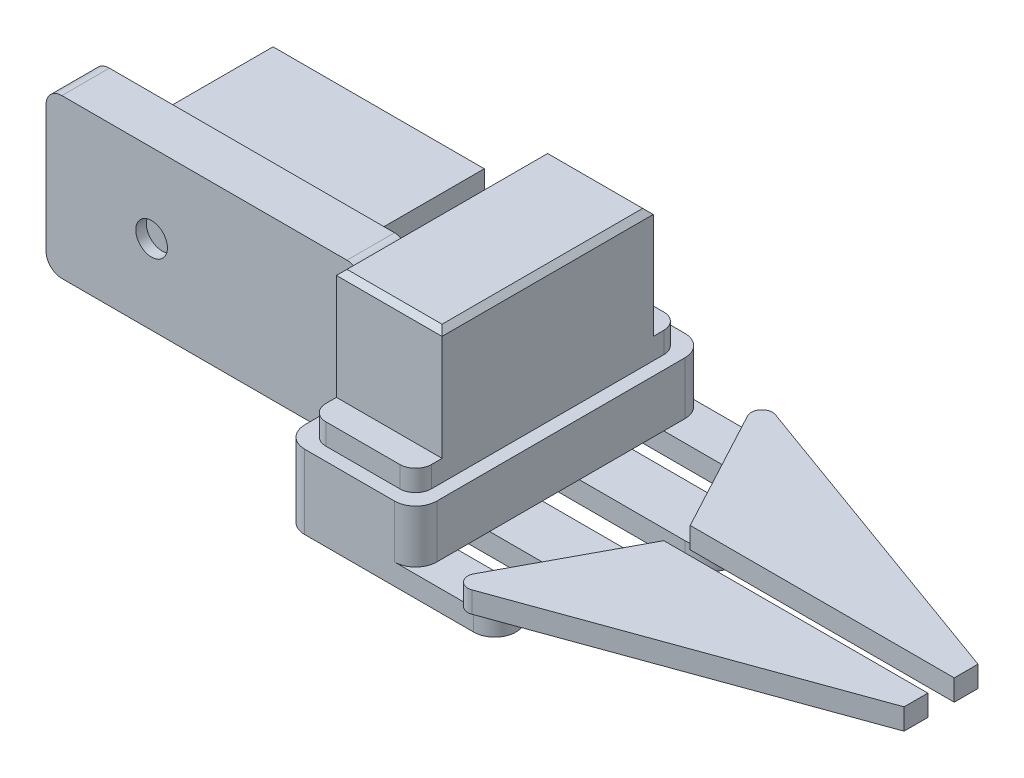
from build123d import *

# Parameters (mm, degrees)
SKETCH_1_W          = 60
SKETCH_1_H          = 30
EXTRUDE_1_DEPTH     = 9
SKETCH_2_W          = 25
SKETCH_2_H          = 55
EXTRUDE_2_DEPTH     = 10
SKETCH_3_W          = 20
SKETCH_3_H          = 40
EXTRUDE_3_DEPTH     = 25
SKETCH_4_W          = 20
SKETCH_4_H          = 5
EXTRUDE_4_DEPTH     = 4
FILLET_1_R          = 4
FILLET_2_R          = 3
FILLET_3_R          = 3
EXTRUDE_5_DEPTH     = 4
EXTRUDE_6_DEPTH     = 4
FILLET_4_R          = 2
CHAMFER_1_SIZE      = 1
SKETCH_7_W          = 40
SKETCH_7_H          = 20
EXTRUDE_7_DEPTH     = 25
SKETCH_8_W          = 5
SKETCH_8_H          = 20
EXTRUDE_8_DEPTH     = 4
CHAMFER_2_SIZE      = 1
FILLET_6_R          = 2
SKETCH_9_R          = 3
CUT_EXTRUDE_1_DEPTH = 2


with BuildPart() as part:
    # 草图1 → 凸台-拉伸1 (new body)
    with BuildSketch(Plane.XY):
        Rectangle(SKETCH_1_W, SKETCH_1_H)
    extrude(amount=EXTRUDE_1_DEPTH)

    # 草图2 → 凸台-拉伸2 (add)
    with BuildSketch(Plane.XZ.offset(15)):
        with Locations((42.5, -3.5)):
            Rectangle(SKETCH_2_W, SKETCH_2_H)
    extrude(amount=-EXTRUDE_2_DEPTH)

    # 草图3 → 凸台-拉伸3 (add)
    with BuildSketch(Plane(origin=(0, -5, 0), x_dir=(1, 0, 0), z_dir=(0, 1, 0))):
        with Locations((42.5, 3.5)):
            Rectangle(SKETCH_3_W, SKETCH_3_H)
    extrude(amount=EXTRUDE_3_DEPTH)

    # 草图4 → 凸台-拉伸4 (add)
    with BuildSketch(Plane(origin=(0, -5, 0), x_dir=(1, 0, 0), z_dir=(0, 1, 0))):
        with Locations((42.5, 26)):
            Rectangle(SKETCH_4_W, SKETCH_4_H)
        with Locations((42.5, -19)):
            Rectangle(SKETCH_4_W, SKETCH_4_H)
    extrude(amount=EXTRUDE_4_DEPTH)

    # 圆角1
    fillet_1_edges = [part.edges().sort_by_distance(p)[0] for p in [
        (30, -10, -31),
        (30, -10, 24),
        (55, -10, 24),
        (55, -10, -31),
    ]]
    fillet(fillet_1_edges, radius=FILLET_1_R)

    # 圆角2
    fillet_2_edges = [part.edges().sort_by_distance(p)[0] for p in [
        (52.5, -3, -28.5),
        (32.5, -3, -28.5),
        (52.5, -3, 21.5),
        (32.5, -3, 21.5),
    ]]
    fillet(fillet_2_edges, radius=FILLET_2_R)

    # 圆角3
    fillet_3_edges = [part.edges().sort_by_distance(p)[0] for p in [
        (-30, -15, 4.5),
        (-30, 15, 4.5),
        (30, 15, 4.5),
    ]]
    fillet(fillet_3_edges, radius=FILLET_3_R)

    # 草图5 → 凸台-拉伸5 (add)
    with BuildSketch(Plane.XZ.offset(15)):
        with BuildLine():
            Line((34, 24), (66, 24))
            ThreePointArc((66, 24), (70, 20), (66, 16))
            Line((66, 16), (34, 16))
            ThreePointArc((34, 16), (30, 20), (34, 24))
        make_face()
        with BuildLine():
            Line((35, 10), (75, 10))
            ThreePointArc((75, 10), (80, 5), (75, 0))
            Line((75, 0), (35, 0))
            ThreePointArc((35, 0), (30, 5), (35, 10))
        make_face()
    extrude_5 = extrude(amount=EXTRUDE_5_DEPTH)

    # 镜向1: 凸台-拉伸5 across plane
    add(extrude_5.mirror(Plane(origin=(0, 0, -3.5), x_dir=(1, 0, 0), z_dir=(0, 0, -1))))

    # 草图6 → 凸台-拉伸6 (add)
    with BuildSketch(Plane(origin=(0, -15, 0), x_dir=(1, 0, 0), z_dir=(0, 1, 0))):
        Polygon((62, 34), (77, 6), (127, 6), (127, 10.5), align=None)
    extrude_6 = extrude(amount=EXTRUDE_6_DEPTH)

    # 镜向2: 凸台-拉伸6 across plane
    add(extrude_6.mirror(Plane(origin=(0, 0, -3.5), x_dir=(1, 0, 0), z_dir=(0, 0, -1))))

    # 圆角4
    # the kernel refuses this fillet: 2 mm, written as the material it takes off along each edge
    with BuildSketch(Plane(origin=(62, -15, -34), x_dir=(0.47222141251542, 0, 0.8814799700287814), z_dir=(0, 1, 0))) as fillet_4_piece_1:
        with BuildLine():
            CenterArc((FILLET_4_R * 2.60886248276, FILLET_4_R), FILLET_4_R, 131.944537695, 138.055462305)
            Line((FILLET_4_R * 1.94045155385, FILLET_4_R * 1.74379219551), (0, 0))
            Line((0, 0), (FILLET_4_R * 2.60886248276, 0))
        make_face()
    extrude(amount=17.044312414, mode=Mode.SUBTRACT)
    with BuildSketch(Plane(origin=(62, -15, 27), x_dir=(0.47222141251541977, 0, -0.8814799700287816), z_dir=(0, 1, 0))) as fillet_4_piece_2:
        with BuildLine():
            CenterArc((FILLET_4_R * 2.60886248276, -FILLET_4_R), FILLET_4_R, 90, 138.055462305)
            Line((FILLET_4_R * 1.94045155385, -FILLET_4_R * 1.74379219551), (0, 0))
            Line((0, 0), (FILLET_4_R * 2.60886248276, 0))
        make_face()
    extrude(amount=17.044312414, mode=Mode.SUBTRACT)

    # 倒角1
    chamfer_1_edges = [part.edges().sort_by_distance(p)[0] for p in [
        (32.5, 20, -3.5),
        (42.5, 20, 16.5),
        (52.5, 20, -3.5),
        (42.5, 20, -23.5),
    ]]
    chamfer(chamfer_1_edges, length=CHAMFER_1_SIZE)

    # 草图7 → 凸台-拉伸7 (add)
    with BuildSketch(Plane(origin=(0, 0, 0), x_dir=(-1, 0, 0), z_dir=(0, 0, -1))):
        Rectangle(SKETCH_7_W, SKETCH_7_H)
    extrude(amount=EXTRUDE_7_DEPTH)

    # 草图8 → 凸台-拉伸8 (add)
    with BuildSketch(Plane(origin=(0, 0, 0), x_dir=(-1, 0, 0), z_dir=(0, 0, -1))):
        with Locations((22.5, 0)):
            Rectangle(SKETCH_8_W, SKETCH_8_H)
        with Locations((-22.5, 0)):
            Rectangle(SKETCH_8_W, SKETCH_8_H)
    extrude(amount=EXTRUDE_8_DEPTH)

    # 倒角2
    chamfer_2_edges = [part.edges().sort_by_distance(p)[0] for p in [
        (-20, 0, -25),
        (0, 10, -25),
        (20, 0, -25),
        (0, -10, -25),
    ]]
    chamfer(chamfer_2_edges, length=CHAMFER_2_SIZE)

    # 圆角6
    fillet_6_edges = [part.edges().sort_by_distance(p)[0] for p in [
        (-25, -10, -2),
        (-25, 10, -2),
        (25, 10, -2),
        (25, -10, -2),
    ]]
    fillet(fillet_6_edges, radius=FILLET_6_R)

    # 草图9 → 切除-拉伸1 (cut)
    with BuildSketch(Plane.XY.offset(9)):
        with Locations((-10, 0)):
            Circle(SKETCH_9_R)
    extrude(amount=-CUT_EXTRUDE_1_DEPTH, mode=Mode.SUBTRACT)


solid = part.part
